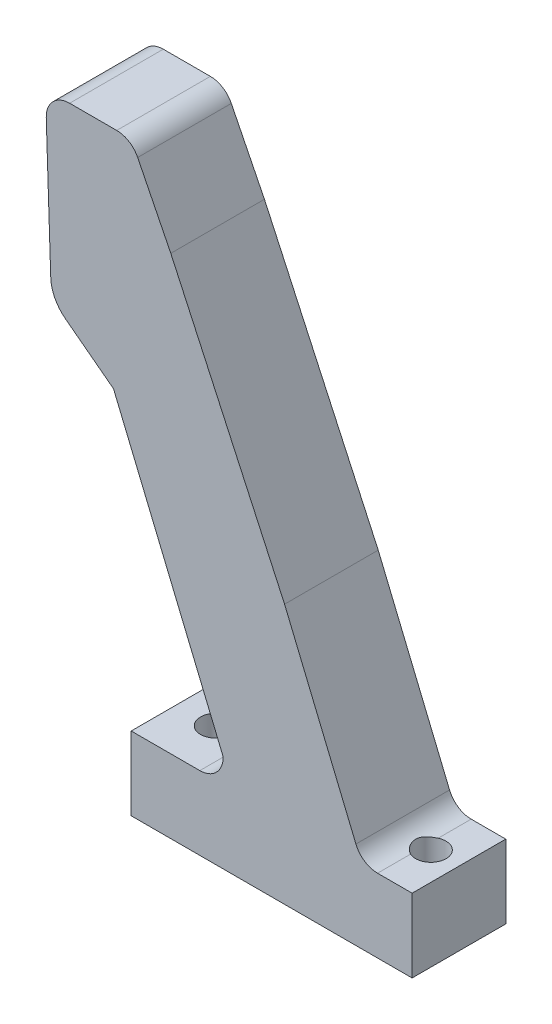
from build123d import *

# Parameters (mm, degrees)
BOSS_EXTRUDE1_DEPTH     = 20
CUT_EXTRUDE1_DEPTH      = 20
CUT_EXTRUDE1_DEPTH_BACK = 20
SKETCH3_R               = 3.25


with BuildPart() as part:
    # Sketch1 → Boss-Extrude1 (new body)
    with BuildSketch(Plane.XY):
        with BuildLine():
            Line((-44.097792079, -29.156477567), (-44.097792079, -44.850100287))
            Line((-44.097792079, -44.850100287), (15.902191644, -44.850100287))
            Line((15.902191644, -44.850100287), (15.902191644, -29.156477567))
            Line((15.902191644, -29.156477567), (8.516601235, -29.156477567))
            ThreePointArc((8.516601235, -29.156477567), (5.739613958, -28.31440273), (3.897999124, -26.071814232))
            Line((3.897999124, -26.071814232), (-11.340504171, 10.673988619))
            Line((-11.340504171, 10.673988619), (-35.64147303, 63.423134111))
            Line((-35.64147303, 63.423134111), (-42.717161807, 77.613253206))
            ThreePointArc((-42.717161807, 77.613253206), (-44.560759506, 79.633890402), (-47.19173837, 80.382073118))
            Line((-47.19173837, 80.382073118), (-57.247452636, 80.382073118))
            ThreePointArc((-57.247452636, 80.382073118), (-60.840851903, 78.8587787), (-62.244729152, 75.217065799))
            Line((-62.244729152, 75.217065799), (-61.293211228, 46.400173199))
            ThreePointArc((-61.293211228, 46.400173199), (-60.463803823, 42.862224873), (-58.148414135, 40.061516822))
            Line((-58.148414135, 40.061516822), (-47.87808719, 32.258784099))
            Line((-47.87808719, 32.258784099), (-24.43830161, -24.156477567))
            ThreePointArc((-24.43830161, -24.156477567), (-25.902767704, -27.692011473), (-29.43830161, -29.156477567))
            Line((-29.43830161, -29.156477567), (-35.915534593, -29.156477567))
            Line((-35.915534593, -29.156477567), (-44.097792079, -29.156477567))
        make_face()
    extrude(amount=BOSS_EXTRUDE1_DEPTH)

    # Sketch3 → Cut-Extrude1 (cut, two sides: drawn at the far end of the back side and taken through both)
    with BuildSketch(Plane(origin=(0, -29.156477567, 0), x_dir=(1, 0, 0), z_dir=(0, 1, 0)).offset(-CUT_EXTRUDE1_DEPTH_BACK)):
        with Locations((9.902191644, -10)):
            Circle(SKETCH3_R)
        with Locations((-36.038433316, -10)):
            Circle(SKETCH3_R)
    extrude(amount=CUT_EXTRUDE1_DEPTH + CUT_EXTRUDE1_DEPTH_BACK, mode=Mode.SUBTRACT)


solid = part.part
